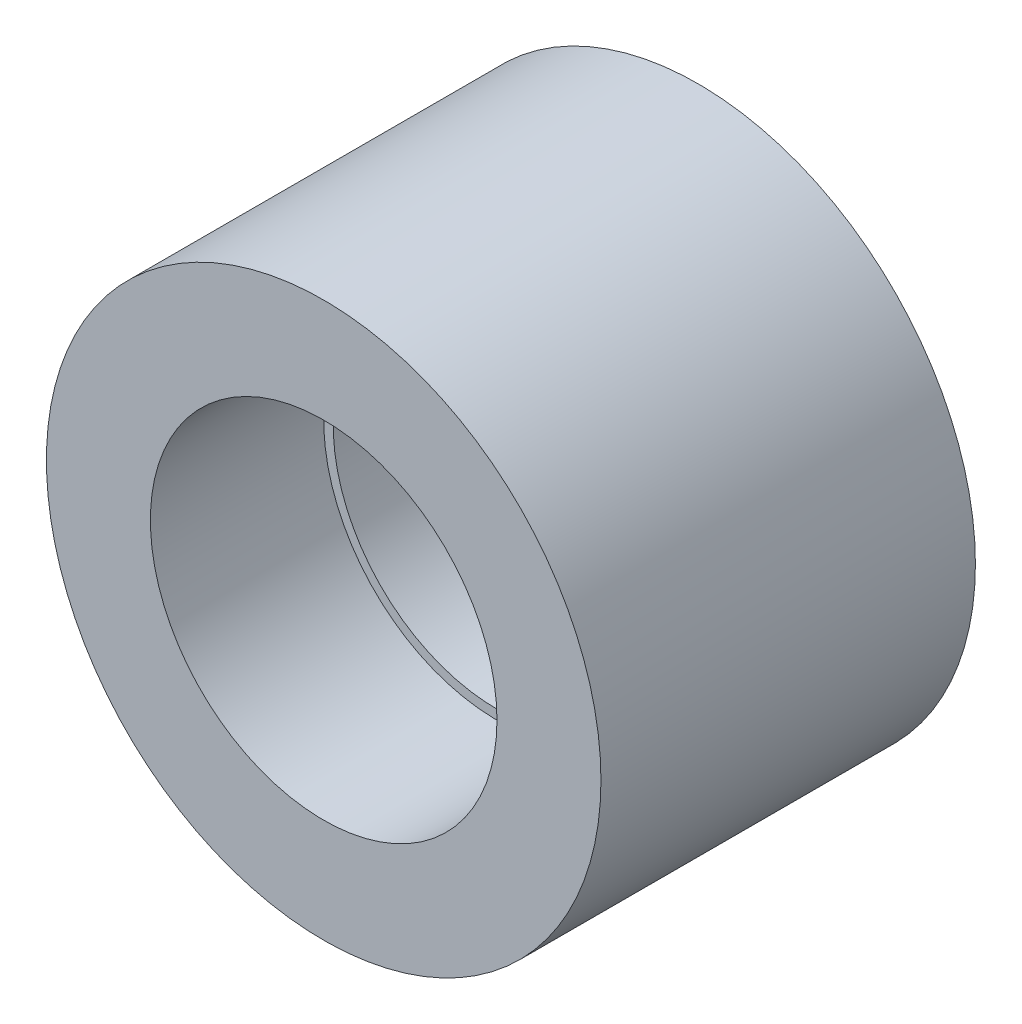
from build123d import *

# Parameters (mm, degrees)
SKETCH1_R           = 5.08
SKETCH1_R_2         = 3.175
BOSS_EXTRUDE1_DEPTH = 3.175
BOSS_EXTRUDE2_START = -3.68554
SKETCH1_3_R         = 5.08
SKETCH1_3_R_2       = 3
BOSS_EXTRUDE2_DEPTH = 3.68554


with BuildPart() as part:
    # Sketch1 → Boss-Extrude1 (new body)
    with BuildSketch(Plane.XY):
        Circle(SKETCH1_R)
        Circle(SKETCH1_R_2, mode=Mode.SUBTRACT)
    extrude(amount=BOSS_EXTRUDE1_DEPTH)

    # Sketch1<3> → Boss-Extrude2 (add)
    with BuildSketch(Plane.XY.offset(BOSS_EXTRUDE2_START)):
        Circle(SKETCH1_3_R)
        Circle(SKETCH1_3_R_2, mode=Mode.SUBTRACT)
    extrude(amount=BOSS_EXTRUDE2_DEPTH)


solid = part.part
